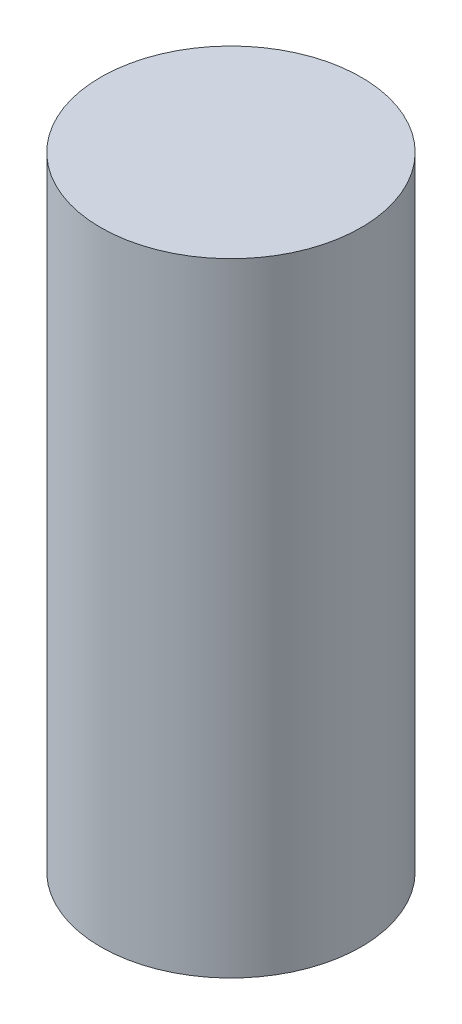
from build123d import *

# Parameters (mm, degrees)
SKETCH1_R           = 3
BOSS_EXTRUDE1_DEPTH = 14.346


with BuildPart() as part:
    # Sketch1 → Boss-Extrude1 (new body)
    with BuildSketch(Plane(origin=(0, 0, 0), x_dir=(1, 0, 0), z_dir=(0, 1, 0))):
        Circle(SKETCH1_R)
    extrude(amount=BOSS_EXTRUDE1_DEPTH)


solid = part.part
